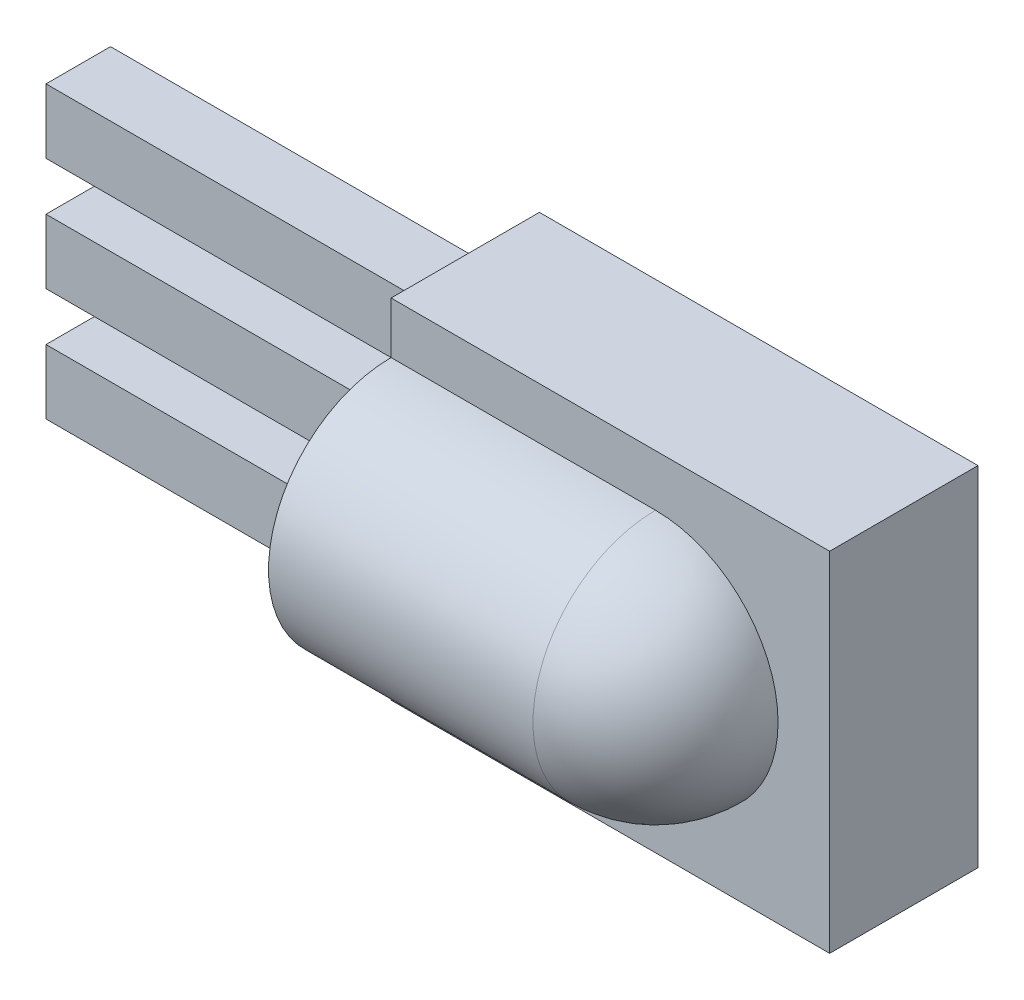
from build123d import *

# Parameters (mm, degrees)
ESQUISSE1_W        = 6.8
ESQUISSE1_H        = 5.4
BOSS_EXTRU_1_DEPTH = 2.3
ESQUISSE2_R        = 1.9
BOSS_EXTRU_2_DEPTH = 6
CONG_1_R           = 1.9
ESQUISSE3_W        = 1
ESQUISSE3_H        = 1
BOSS_EXTRU_3_DEPTH = 6


with BuildPart() as part:
    # Esquisse1 → Boss.-Extru.1 (new body)
    with BuildSketch(Plane.XY):
        with Locations((3.4, 2.7)):
            Rectangle(ESQUISSE1_W, ESQUISSE1_H)
    extrude(amount=BOSS_EXTRU_1_DEPTH)

    # Esquisse2 → Boss.-Extru.2 (add)
    with BuildSketch(Plane.ZY):
        with Locations((2.3, 2.7)):
            Circle(ESQUISSE2_R)
    extrude(amount=-BOSS_EXTRU_2_DEPTH)

    # Congé1
    cong_1_edges = [part.edges().sort_by_distance(p)[0] for p in [
        (6, 2.7, 4.2),
    ]]
    fillet(cong_1_edges, radius=CONG_1_R - 0.0001)  # a hair under: the kernel refuses the full size

    # Esquisse3 → Boss.-Extru.3 (add)
    with BuildSketch(Plane.ZY):
        with Locations((1.15, 4.45)):
            Rectangle(ESQUISSE3_W, ESQUISSE3_H)
        with Locations((1.15, 2.7)):
            Rectangle(ESQUISSE3_W, ESQUISSE3_H)
        with Locations((1.15, 0.95)):
            Rectangle(ESQUISSE3_W, ESQUISSE3_H)
    extrude(amount=BOSS_EXTRU_3_DEPTH)


solid = part.part
